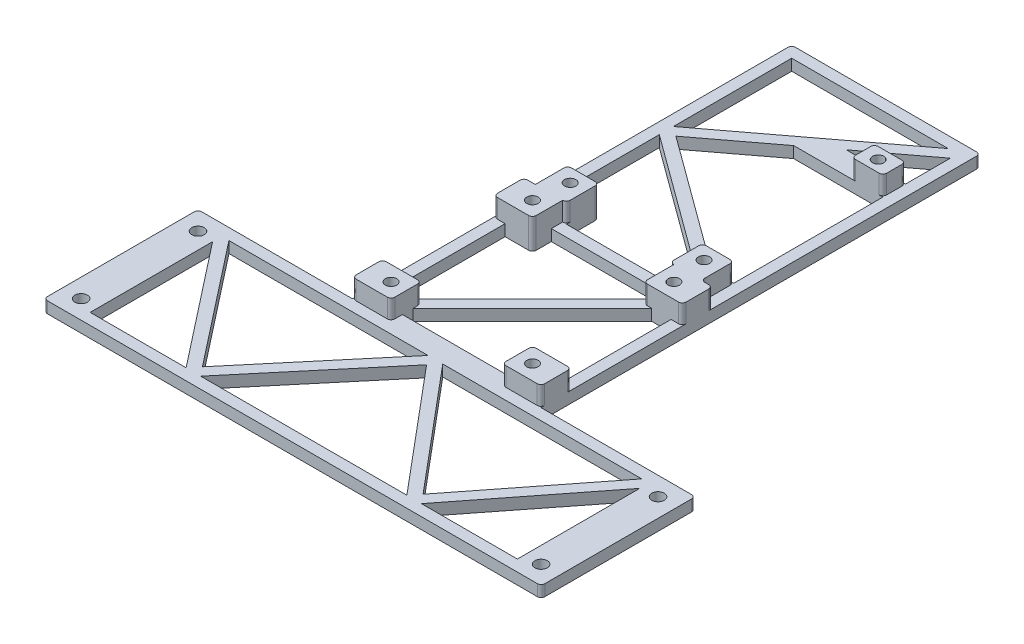
from build123d import *

# Parameters (mm, degrees)
SKETCH1_R           = 1.65
SKETCH1_W           = 29.5
SKETCH1_H           = 3
SKETCH1_R_2         = 1.5
SKETCH1_W_2         = 3
SKETCH1_H_2         = 29.5
SKETCH1_H_3         = 8.6
SKETCH1_W_3         = 8.25
SKETCH1_H_4         = 6
SKETCH1_H_5         = 1.5
BOSS_EXTRUDE1_DEPTH = 3
BOSS_EXTRUDE2_START = 3
SKETCH1_5_R         = 1.5
SKETCH1_5_W         = 8.25
SKETCH1_5_H         = 6
BOSS_EXTRUDE2_DEPTH = 5
FILLET1_R           = 1


with BuildPart() as part:
    # Sketch1 → Boss-Extrude1 (new body)
    # profile 1 of 27: a face of its own
    with BuildSketch(Plane(origin=(0, 0, 0), x_dir=(1, 0, 0), z_dir=(0, 1, 0))):
        Polygon((-56.65, -37.9), (-56.65, -40.9), (56.65, -40.9), (56.65, -37.9), (31.205729157, -37.9), (27.341462913, -37.9), (-27.341462913, -37.9), (-31.205729157, -37.9), align=None)
    # profile 2 of 27: a face of its own
    with BuildSketch(Plane(origin=(0, 0, 0), x_dir=(1, 0, 0), z_dir=(0, 1, 0))):
        Polygon((-65.95, 0), (-65.95, -40.9), (-56.65, -40.9), (-56.65, -37.9), (-56.65, -5.431807955), (-56.65, -3), (-56.65, 0), align=None)
        with Locations(Location((-61, -35.95, 0), (0, 0, 270))):
            Circle(SKETCH1_R, mode=Mode.SUBTRACT)
        with Locations(Location((-61, -4.95, 0), (0, 0, 270))):
            Circle(SKETCH1_R, mode=Mode.SUBTRACT)
    # profile 3 of 27: a face of its own
    with BuildSketch(Plane(origin=(0, 0, 0), x_dir=(1, 0, 0), z_dir=(0, 1, 0))):
        Polygon((-56.65, -3), (-56.65, -5.431807955), (-31.205729157, -37.9), (-27.341462913, -37.9), (0, -5.332864995), (27.341462913, -37.9), (31.205729157, -37.9), (56.65, -5.431807955), (56.65, -3), (54.744270843, -3), (29.259896294, -35.519366427), (1.958537087, -3), (-1.958537087, -3), (-29.259896294, -35.519366427), (-54.744270843, -3), align=None)
    # profile 4 of 27: a face of its own
    with BuildSketch(Plane(origin=(0, 0, 0), x_dir=(1, 0, 0), z_dir=(0, 1, 0))):
        Polygon((56.65, -37.9), (56.65, -40.9), (65.95, -40.9), (65.95, 0), (56.65, 0), (56.65, -3), (56.65, -5.431807955), align=None)
        with Locations(Location((61, -35.95, 0), (0, 0, 270))):
            Circle(SKETCH1_R, mode=Mode.SUBTRACT)
        with Locations(Location((61, -4.95, 0), (0, 0, 270))):
            Circle(SKETCH1_R, mode=Mode.SUBTRACT)
    # profile 5 of 27: a face of its own
    with BuildSketch(Plane(origin=(0, 0, 0), x_dir=(1, 0, 0), z_dir=(0, 1, 0))):
        Polygon((-25, 0), (-56.65, 0), (-56.65, -3), (-54.744270843, -3), (-1.958537087, -3), (1.958537087, -3), (54.744270843, -3), (56.65, -3), (56.65, 0), (25, 0), (14.75, 0), (-14.75, 0), align=None)
    # profile 6 of 27: a face of its own
    with BuildSketch(Plane(origin=(0, 0, 0), x_dir=(1, 0, 0), z_dir=(0, 1, 0))):
        with Locations((0, 1.5)):
            Rectangle(SKETCH1_W, SKETCH1_H)
    # profile 7 of 27: a face of its own
    with BuildSketch(Plane(origin=(0, 0, 0), x_dir=(1, 0, 0), z_dir=(0, 1, 0))):
        Polygon((14.75, 3), (14.75, 0), (25, 0), (25, 8), (22, 8), (14.75, 8), align=None)
        with Locations(Location((18.75, 4, 0), (0, 0, 270))):
            Circle(SKETCH1_R_2, mode=Mode.SUBTRACT)
    # profile 8 of 27: a face of its own
    with BuildSketch(Plane(origin=(0, 0, 0), x_dir=(1, 0, 0), z_dir=(0, 1, 0))):
        Polygon((-25, 8), (-25, 0), (-14.75, 0), (-14.75, 3), (-14.75, 5.878679656), (-14.75, 8), (-16.871320344, 8), (-22, 8), align=None)
        with Locations(Location((-18.75, 4, 0), (0, 0, 270))):
            Circle(SKETCH1_R_2, mode=Mode.SUBTRACT)
    # profile 9 of 27: a face of its own
    with BuildSketch(Plane(origin=(0, 0, 0), x_dir=(1, 0, 0), z_dir=(0, 1, 0))):
        with Locations((23.5, 22.75)):
            Rectangle(SKETCH1_W_2, SKETCH1_H_2)
    # profile 10 of 27: a face of its own
    with BuildSketch(Plane(origin=(0, 0, 0), x_dir=(1, 0, 0), z_dir=(0, 1, 0))):
        Polygon((-14.75, 8), (-14.75, 5.878679656), (16.871320344, 37.5), (14.75, 37.5), (14.75, 39.621320344), (-16.871320344, 8), align=None)
    # profile 11 of 27: a face of its own
    with BuildSketch(Plane(origin=(0, 0, 0), x_dir=(1, 0, 0), z_dir=(0, 1, 0))):
        with Locations((-23.5, 22.75)):
            Rectangle(SKETCH1_W_2, SKETCH1_H_2)
    # profile 12 of 27: a face of its own
    with BuildSketch(Plane(origin=(0, 0, 0), x_dir=(1, 0, 0), z_dir=(0, 1, 0))):
        Polygon((14.75, 37.5), (16.871320344, 37.5), (22, 37.5), (25, 37.5), (25, 45.5), (22, 45.5), (14.75, 45.5), (14.75, 42.5), (14.75, 39.621320344), align=None)
        with Locations(Location((18.75, 41.5, 0), (0, 0, 270))):
            Circle(SKETCH1_R_2, mode=Mode.SUBTRACT)
    # profile 13 of 27: a face of its own
    with BuildSketch(Plane(origin=(0, 0, 0), x_dir=(1, 0, 0), z_dir=(0, 1, 0))):
        Polygon((-13.75, 45.5), (-14.75, 45.5), (-14.75, 42.5), (14.75, 42.5), (14.75, 45.5), (13.75, 45.5), align=None)
    # profile 14 of 27: a face of its own
    with BuildSketch(Plane(origin=(0, 0, 0), x_dir=(1, 0, 0), z_dir=(0, 1, 0))):
        Polygon((-25, 45.5), (-25, 37.5), (-22, 37.5), (-14.75, 37.5), (-14.75, 42.5), (-14.75, 45.5), (-22, 45.5), align=None)
        with Locations(Location((-18.75, 41.5, 0), (0, 0, 270))):
            Circle(SKETCH1_R_2, mode=Mode.SUBTRACT)
    # profile 15 of 27: a face of its own
    with BuildSketch(Plane(origin=(0, 0, 0), x_dir=(1, 0, 0), z_dir=(0, 1, 0))):
        Polygon((-22, 54.1), (-22, 45.5), (-14.75, 45.5), (-13.75, 45.5), (-13.75, 54.1), align=None)
        with Locations(Location((-17.75, 50.5, 0), (0, 0, 270))):
            Circle(SKETCH1_R_2, mode=Mode.SUBTRACT)
    # profile 16 of 27: a face of its own
    with BuildSketch(Plane(origin=(0, 0, 0), x_dir=(1, 0, 0), z_dir=(0, 1, 0))):
        with Locations((-23.5, 49.8)):
            Rectangle(SKETCH1_W_2, SKETCH1_H_3)
    # profile 17 of 27: a face of its own
    with BuildSketch(Plane(origin=(0, 0, 0), x_dir=(1, 0, 0), z_dir=(0, 1, 0))):
        Polygon((13.75, 45.5), (14.75, 45.5), (22, 45.5), (22, 54.1), (16.290717268, 54.1), (13.75, 54.1), (13.75, 52.241545271), align=None)
        with Locations(Location((17.75, 50.5, 0), (0, 0, 270))):
            Circle(SKETCH1_R_2, mode=Mode.SUBTRACT)
    # profile 18 of 27: a face of its own
    with BuildSketch(Plane(origin=(0, 0, 0), x_dir=(1, 0, 0), z_dir=(0, 1, 0))):
        with Locations((23.5, 49.8)):
            Rectangle(SKETCH1_W_2, SKETCH1_H_3)
    # profile 19 of 27: a face of its own
    with BuildSketch(Plane(origin=(0, 0, 0), x_dir=(1, 0, 0), z_dir=(0, 1, 0))):
        Polygon((-22, 82.130125999), (-22, 78.391545271), (13.75, 52.241545271), (13.75, 54.1), (16.290717268, 54.1), (-19.459282732, 80.25), (-1.660786492, 93.7), (6.279063132, 99.7), (22, 111.580026156), (22, 113.5), (19.512013715, 113.5), align=None)
    # profile 20 of 27: a face of its own
    with BuildSketch(Plane(origin=(0, 0, 0), x_dir=(1, 0, 0), z_dir=(0, 1, 0))):
        Polygon((22, 54.1), (25, 54.1), (25, 113.5), (22, 113.5), (22, 111.580026156), (22, 99.7), (22, 93.7), align=None)
    # profile 21 of 27: a face of its own
    with BuildSketch(Plane(origin=(0, 0, 0), x_dir=(1, 0, 0), z_dir=(0, 1, 0))):
        Polygon((-25, 113.5), (-25, 54.1), (-22, 54.1), (-22, 78.391545271), (-22, 82.130125999), (-22, 113.5), align=None)
    # profile 22 of 27: a face of its own
    with BuildSketch(Plane(origin=(0, 0, 0), x_dir=(1, 0, 0), z_dir=(0, 1, 0))):
        Polygon((-1.660786492, 93.7), (13.75, 93.7), (13.75, 99.7), (6.279063132, 99.7), align=None)
    # profile 23 of 27: a face of its own
    with BuildSketch(Plane(origin=(0, 0, 0), x_dir=(1, 0, 0), z_dir=(0, 1, 0))):
        with Locations((17.875, 96.7)):
            Rectangle(SKETCH1_W_3, SKETCH1_H_4)
        with Locations(Location((17.75, 96.7, 0), (0, 0, 270))):
            Circle(SKETCH1_R_2, mode=Mode.SUBTRACT)
    # profile 24 of 27: a face of its own
    with BuildSketch(Plane(origin=(0, 0, 0), x_dir=(1, 0, 0), z_dir=(0, 1, 0))):
        Polygon((-22, 115), (-22, 113.5), (19.512013715, 113.5), (22, 113.5), (22, 115), align=None)
    # profile 25 of 27: a face of its own
    with BuildSketch(Plane(origin=(0, 0, 0), x_dir=(1, 0, 0), z_dir=(0, 1, 0))):
        Polygon((-25, 116.5), (-25, 115), (-22, 115), (22, 115), (25, 115), (25, 116.5), align=None)
    # profile 26 of 27: a face of its own
    with BuildSketch(Plane(origin=(0, 0, 0), x_dir=(1, 0, 0), z_dir=(0, 1, 0))):
        with Locations((23.5, 114.25)):
            Rectangle(SKETCH1_W_2, SKETCH1_H_5)
    # profile 27 of 27: a face of its own
    with BuildSketch(Plane(origin=(0, 0, 0), x_dir=(1, 0, 0), z_dir=(0, 1, 0))):
        with Locations((-23.5, 114.25)):
            Rectangle(SKETCH1_W_2, SKETCH1_H_5)
    extrude(amount=BOSS_EXTRUDE1_DEPTH)

    # Sketch1<5> → Boss-Extrude2 (add)
    # profile 1 of 7: a face of its own
    with BuildSketch(Plane(origin=(0, 0, 0), x_dir=(1, 0, 0), z_dir=(0, 1, 0)).offset(BOSS_EXTRUDE2_START)):
        Polygon((14.75, 3), (14.75, 0), (25, 0), (25, 8), (22, 8), (14.75, 8), align=None)
        with Locations(Location((18.75, 4, 0), (0, 0, 270))):
            Circle(SKETCH1_5_R, mode=Mode.SUBTRACT)
    # profile 2 of 7: a face of its own
    with BuildSketch(Plane(origin=(0, 0, 0), x_dir=(1, 0, 0), z_dir=(0, 1, 0)).offset(BOSS_EXTRUDE2_START)):
        Polygon((-25, 8), (-25, 0), (-14.75, 0), (-14.75, 3), (-14.75, 5.878679656), (-14.75, 8), (-16.871320344, 8), (-22, 8), align=None)
        with Locations(Location((-18.75, 4, 0), (0, 0, 270))):
            Circle(SKETCH1_5_R, mode=Mode.SUBTRACT)
    # profile 3 of 7: a face of its own
    with BuildSketch(Plane(origin=(0, 0, 0), x_dir=(1, 0, 0), z_dir=(0, 1, 0)).offset(BOSS_EXTRUDE2_START)):
        Polygon((14.75, 37.5), (16.871320344, 37.5), (22, 37.5), (25, 37.5), (25, 45.5), (22, 45.5), (14.75, 45.5), (14.75, 42.5), (14.75, 39.621320344), align=None)
        with Locations(Location((18.75, 41.5, 0), (0, 0, 270))):
            Circle(SKETCH1_5_R, mode=Mode.SUBTRACT)
    # profile 4 of 7: a face of its own
    with BuildSketch(Plane(origin=(0, 0, 0), x_dir=(1, 0, 0), z_dir=(0, 1, 0)).offset(BOSS_EXTRUDE2_START)):
        Polygon((-25, 45.5), (-25, 37.5), (-22, 37.5), (-14.75, 37.5), (-14.75, 42.5), (-14.75, 45.5), (-22, 45.5), align=None)
        with Locations(Location((-18.75, 41.5, 0), (0, 0, 270))):
            Circle(SKETCH1_5_R, mode=Mode.SUBTRACT)
    # profile 5 of 7: a face of its own
    with BuildSketch(Plane(origin=(0, 0, 0), x_dir=(1, 0, 0), z_dir=(0, 1, 0)).offset(BOSS_EXTRUDE2_START)):
        Polygon((13.75, 45.5), (14.75, 45.5), (22, 45.5), (22, 54.1), (16.290717268, 54.1), (13.75, 54.1), (13.75, 52.241545271), align=None)
        with Locations(Location((17.75, 50.5, 0), (0, 0, 270))):
            Circle(SKETCH1_5_R, mode=Mode.SUBTRACT)
    # profile 6 of 7: a face of its own
    with BuildSketch(Plane(origin=(0, 0, 0), x_dir=(1, 0, 0), z_dir=(0, 1, 0)).offset(BOSS_EXTRUDE2_START)):
        Polygon((-22, 54.1), (-22, 45.5), (-14.75, 45.5), (-13.75, 45.5), (-13.75, 54.1), align=None)
        with Locations(Location((-17.75, 50.5, 0), (0, 0, 270))):
            Circle(SKETCH1_5_R, mode=Mode.SUBTRACT)
    # profile 7 of 7: a face of its own
    with BuildSketch(Plane(origin=(0, 0, 0), x_dir=(1, 0, 0), z_dir=(0, 1, 0)).offset(BOSS_EXTRUDE2_START)):
        with Locations((17.875, 96.7)):
            Rectangle(SKETCH1_5_W, SKETCH1_5_H)
        with Locations(Location((17.75, 96.7, 0), (0, 0, 270))):
            Circle(SKETCH1_5_R, mode=Mode.SUBTRACT)
    extrude(amount=BOSS_EXTRUDE2_DEPTH)

    # Fillet1
    fillet1_edges = [part.edges().sort_by_distance(p)[0] for p in [
        (14.75, 4, -8),
        (-14.75, 4, -37.5),
        (-13.75, 4, -54.1),
        (65.95, 1.5, 0),
        (65.95, 1.5, 40.9),
        (-65.95, 1.5, 40.9),
        (-65.95, 1.5, 0),
        (-25, 1.5, -116.5),
        (25, 1.5, -116.5),
        (14.75, 5.5, 0),
        (25, 5.5, 0),
        (25, 5.5, -8),
        (-25, 5.5, -8),
        (-25, 5.5, 0),
        (-14.75, 5.5, 0),
        (-14.75, 5.5, -8),
        (13.75, 5.5, -45.5),
        (14.75, 5.5, -37.5),
        (25, 5.5, -37.5),
        (25, 5.5, -45.5),
        (22, 5.5, -45.5),
        (22, 5.5, -54.1),
        (13.75, 5.5, -54.1),
        (-13.75, 5.5, -45.5),
        (-22, 5.5, -54.1),
        (-25, 5.5, -45.5),
        (-25, 5.5, -37.5),
        (13.75, 5.5, -93.7),
        (22, 5.5, -93.7),
        (22, 5.5, -99.7),
        (13.75, 5.5, -99.7),
    ]]
    fillet(fillet1_edges, radius=FILLET1_R - 0.0001)  # a hair under: the kernel refuses the full size


solid = part.part
